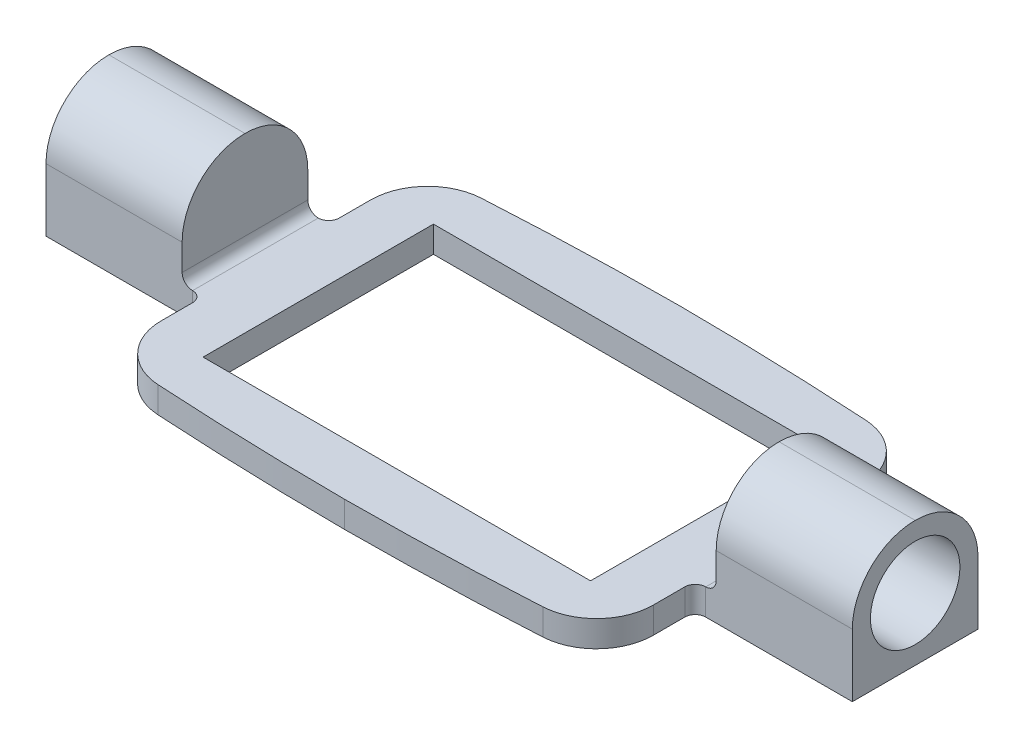
from build123d import *

# Parameters (mm, degrees)
SKETCH2_W           = 93.98
SKETCH2_H           = 55.88
BOSS_EXTRUDE1_DEPTH = 6.35
SKETCH3_W           = 33.02
SKETCH3_H           = 30.48
BOSS_EXTRUDE2_DEPTH = 24.13
FILLET1_R           = 2.54
SKETCH4_R           = 10.8585
CUT_EXTRUDE1_DEPTH  = 25.4
CUT_EXTRUDE2_START  = -25.4
SKETCH5_R           = 10.8585
CUT_EXTRUDE2_DEPTH  = 25.4
FILLET2_R           = 2.54
FILLET3_R           = 15.24


with BuildPart() as part:
    # Sketch2 → Boss-Extrude1 (new body)
    with BuildSketch(Plane(origin=(0, 0, 0), x_dir=(1, 0, 0), z_dir=(0, 1, 0))):
        with BuildLine():
            ThreePointArc((-93.688069253, -11.244332686), (-70.349230661, -12.298232488), (-46.99, -12.696270789))
            ThreePointArc((-46.99, -12.696270789), (-23.630769339, -12.298232488), (-0.291930747, -11.244332686))
            ThreePointArc((-0.291930747, -11.244332686), (8.940138318, -6.930983214), (12.7, 2.54))
            Line((12.7, 2.54), (12.7, 12.7))
            Line((12.7, 12.7), (50.8, 12.7))
            Line((50.8, 12.7), (50.8, 43.18))
            Line((50.8, 43.18), (12.7, 43.18))
            Line((12.7, 43.18), (12.7, 53.34))
            ThreePointArc((12.7, 53.34), (8.940138318, 62.810983214), (-0.291930747, 67.124332686))
            ThreePointArc((-0.291930747, 67.124332686), (-23.630769339, 68.178232488), (-46.99, 68.576270789))
            ThreePointArc((-46.99, 68.576270789), (-70.349230661, 68.178232488), (-93.688069253, 67.124332686))
            ThreePointArc((-93.688069253, 67.124332686), (-102.920138318, 62.810983214), (-106.68, 53.34))
            Line((-106.68, 53.34), (-106.68, 43.18))
            Line((-106.68, 43.18), (-144.78, 43.18))
            Line((-144.78, 43.18), (-144.78, 12.7))
            Line((-144.78, 12.7), (-106.68, 12.7))
            Line((-106.68, 12.7), (-106.68, 2.54))
            ThreePointArc((-106.68, 2.54), (-102.920138318, -6.930983214), (-93.688069253, -11.244332686))
        make_face()
        with Locations((-46.99, 27.94)):
            Rectangle(SKETCH2_W, SKETCH2_H, mode=Mode.SUBTRACT)
    extrude(amount=BOSS_EXTRUDE1_DEPTH)

    # Sketch3 → Boss-Extrude2 (add)
    with BuildSketch(Plane(origin=(0, 6.35, 0), x_dir=(1, 0, 0), z_dir=(0, 1, 0))):
        with Locations((34.29, 27.94)):
            Rectangle(SKETCH3_W, SKETCH3_H)
        with Locations((-128.27, 27.94)):
            Rectangle(SKETCH3_W, SKETCH3_H)
    extrude(amount=BOSS_EXTRUDE2_DEPTH)

    # Fillet1
    fillet1_edges = [part.edges().sort_by_distance(p)[0] for p in [
        (17.78, 6.35, -27.94),
        (-111.76, 6.35, -27.94),
    ]]
    fillet(fillet1_edges, radius=FILLET1_R)

    # Sketch4 → Cut-Extrude1 (cut)
    with BuildSketch(Plane(origin=(50.8, 0, 0), x_dir=(0, 0, -1), z_dir=(1, 0, 0))):
        with Locations((27.94, 15.24)):
            Circle(SKETCH4_R)
    extrude(amount=-CUT_EXTRUDE1_DEPTH, mode=Mode.SUBTRACT)

    # Sketch5 → Cut-Extrude2 (cut)
    with BuildSketch(Plane.ZY.offset(144.78).offset(CUT_EXTRUDE2_START)):
        with Locations(Location((-27.94, 15.24, 0), (0, 0, 180))):
            Circle(SKETCH5_R)
    extrude(amount=CUT_EXTRUDE2_DEPTH, mode=Mode.SUBTRACT)

    # Fillet2
    fillet2_edges = [part.edges().sort_by_distance(p)[0] for p in [
        (12.7, 3.175, -43.18),
        (12.7, 3.175, -12.7),
        (-106.68, 3.175, -43.18),
        (-106.68, 3.175, -12.7),
    ]]
    fillet(fillet2_edges, radius=FILLET2_R)

    # Fillet3
    fillet3_edges = [part.edges().sort_by_distance(p)[0] for p in [
        (34.29, 30.48, -43.18),
        (34.29, 30.48, -12.7),
        (-128.27, 30.48, -43.18),
        (-128.27, 30.48, -12.7),
    ]]
    fillet(fillet3_edges, radius=FILLET3_R - 0.0001)  # a hair under: the kernel refuses the full size


solid = part.part
